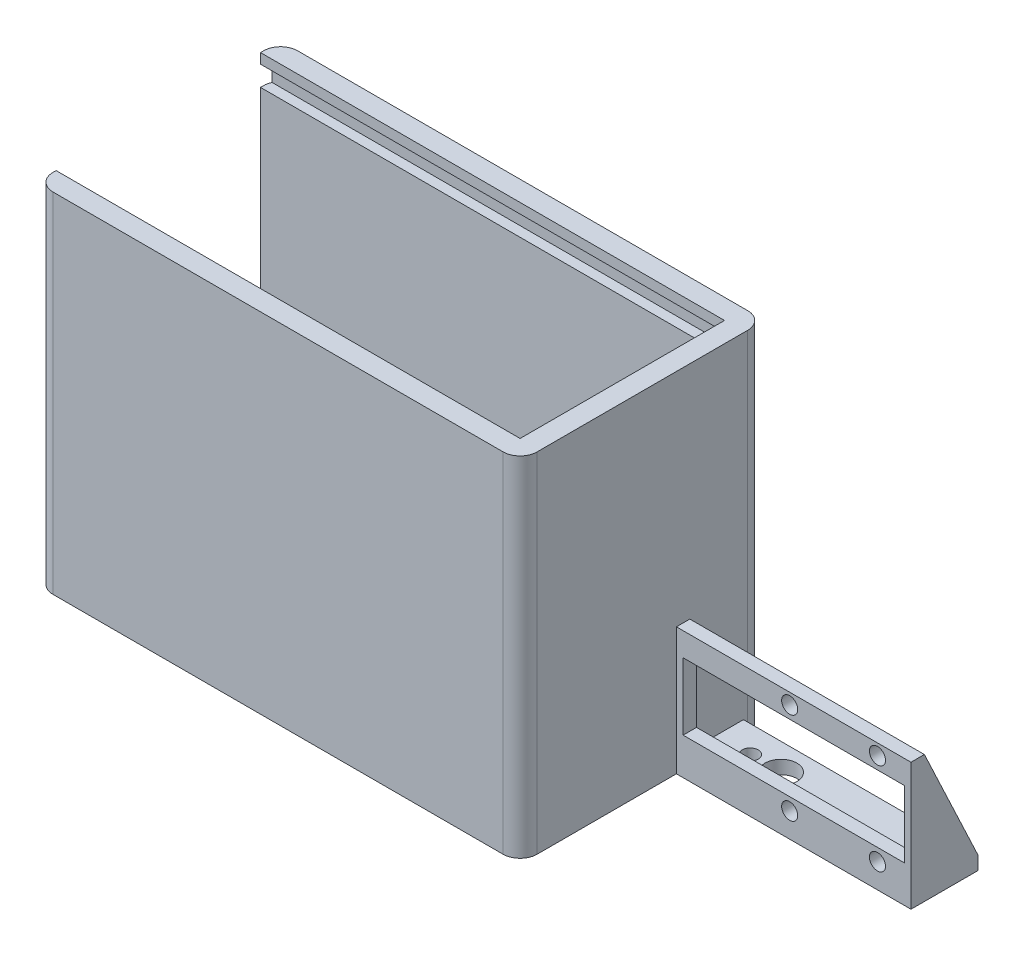
from build123d import *

# Parameters (mm, degrees)
SKETCH1_W            = 35
SKETCH1_H            = 17
BOSS_EXTRUDE1_DEPTH  = 2
M2_CLEARANCE_HOLE1_D = 2.4
SKETCH6_W            = 35
SKETCH6_H            = 10
BOSS_EXTRUDE2_DEPTH  = 2
SKETCH7_W            = 33
SKETCH7_H            = 10
CUT_EXTRUDE1_DEPTH   = 41.174618853
M2_CLEARANCE_HOLE2_D = 2.4
SKETCH10_W           = 36.5
SKETCH10_H           = 2
BOSS_EXTRUDE3_DEPTH  = 72.237500028
BOSS_EXTRUDE4_DEPTH  = 50
CUT_EXTRUDE2_DEPTH   = 69.237500028
BOSS_EXTRUDE5_DEPTH  = 1
FILLET1_R            = 2.54
SKETCH15_R           = 2.38125
CUT_EXTRUDE3_DEPTH   = 93.539786229


with BuildPart() as part:
    # Sketch1 → Boss-Extrude1 (new body)
    with BuildSketch(Plane.XY):
        with Locations((17.5, 8.5)):
            Rectangle(SKETCH1_W, SKETCH1_H)
    extrude(amount=BOSS_EXTRUDE1_DEPTH)

    # M2 Clearance Hole1 (through all)
    with Locations(Plane.XY.offset(2)):
        with Locations((16.9, 15.35), (30, 15.35), (30, 1.65), (16.9, 1.65)):
            Hole(M2_CLEARANCE_HOLE1_D / 2)

    # Sketch6 → Boss-Extrude2 (add)
    with BuildSketch(Plane.XZ):
        with Locations((17.5, -3)):
            Rectangle(SKETCH6_W, SKETCH6_H)
    extrude(amount=BOSS_EXTRUDE2_DEPTH)

    # Sketch7 → Cut-Extrude1 (cut, through all)
    with BuildSketch(Plane.XY.offset(2)):
        with Locations((17.5, 8.5)):
            Rectangle(SKETCH7_W, SKETCH7_H)
    extrude(amount=-CUT_EXTRUDE1_DEPTH, mode=Mode.SUBTRACT)

    # M2 Clearance Hole2 (through all)
    with Locations(Plane(origin=(0, 0, 0), x_dir=(1, 0, 0), z_dir=(0, 1, 0))):
        with Locations((30, 4), (5, 4)):
            Hole(M2_CLEARANCE_HOLE2_D / 2)

    # Sketch10 → Boss-Extrude3 (add)
    with BuildSketch(Plane.ZY):
        with Locations((7.075, -1)):
            Rectangle(SKETCH10_W, SKETCH10_H)
    extrude(amount=BOSS_EXTRUDE3_DEPTH)

    # Sketch11 → Boss-Extrude4 (add)
    with BuildSketch(Plane(origin=(0, 0, 0), x_dir=(1, 0, 0), z_dir=(0, 1, 0))):
        Polygon((0, -25.325), (-72.237500028, -25.325), (-72.237500028, -22.325), (-69.237500028, -22.325), (-3, -22.325), (-3, 8.175), (-69.237500028, 8.175), (-72.237500028, 8.175), (-72.237500028, 11.175), (0, 11.175), align=None)
    extrude(amount=BOSS_EXTRUDE4_DEPTH)

    # Sketch12 → Cut-Extrude2 (cut)
    with BuildSketch(Plane.ZY.offset(72.237500028)):
        Polygon((23.825, 48.5), (22.325, 48.5), (-8.175, 48.5), (-9.675, 48.5), (-9.675, 45.5), (-8.175, 45.5), (22.325, 45.5), (23.825, 45.5), align=None)
    extrude(amount=-CUT_EXTRUDE2_DEPTH, mode=Mode.SUBTRACT)

    # Sketch14 → Boss-Extrude5 (add)
    with BuildSketch(Plane(origin=(35, 0, 0), x_dir=(0, 0, -1), z_dir=(1, 0, 0))):
        Polygon((8, 0), (0, 17), (0, 0), align=None)
    extrude(amount=-BOSS_EXTRUDE5_DEPTH)

    # Fillet1
    # the kernel refuses this fillet: 2.54 mm, written as the material it takes off along each edge
    with BuildSketch(Plane(origin=(0, 56.35, 25.325), x_dir=(0, 0, -1), z_dir=(0, -1, 0)), Plane(origin=(-72.237500028, 56.35, 25.325), x_dir=(1, 0, 0), z_dir=(0, -1, 0)), Plane(origin=(-72.237500028, -8.35, -11.175), x_dir=(1, 0, 0), z_dir=(0, 1, 0)), Plane(origin=(0, -8.35, -11.175), x_dir=(0, 0, 1), z_dir=(0, 1, 0))) as fillet1_piece_1:
        with BuildLine():
            CenterArc((FILLET1_R, -FILLET1_R), FILLET1_R, 90, 90)
            Line((0, -FILLET1_R), (0, 0))
            Line((0, 0), (FILLET1_R, 0))
        make_face()
    extrude(amount=64.7, mode=Mode.SUBTRACT)

    # Sketch15 → Cut-Extrude3 (cut, through all)
    with BuildSketch(Plane.XZ.offset(2)):
        with Locations(Location((9.6, -4, 0), (0, 0, 270))):
            Circle(SKETCH15_R)
    extrude(amount=-CUT_EXTRUDE3_DEPTH, mode=Mode.SUBTRACT)


solid = part.part
